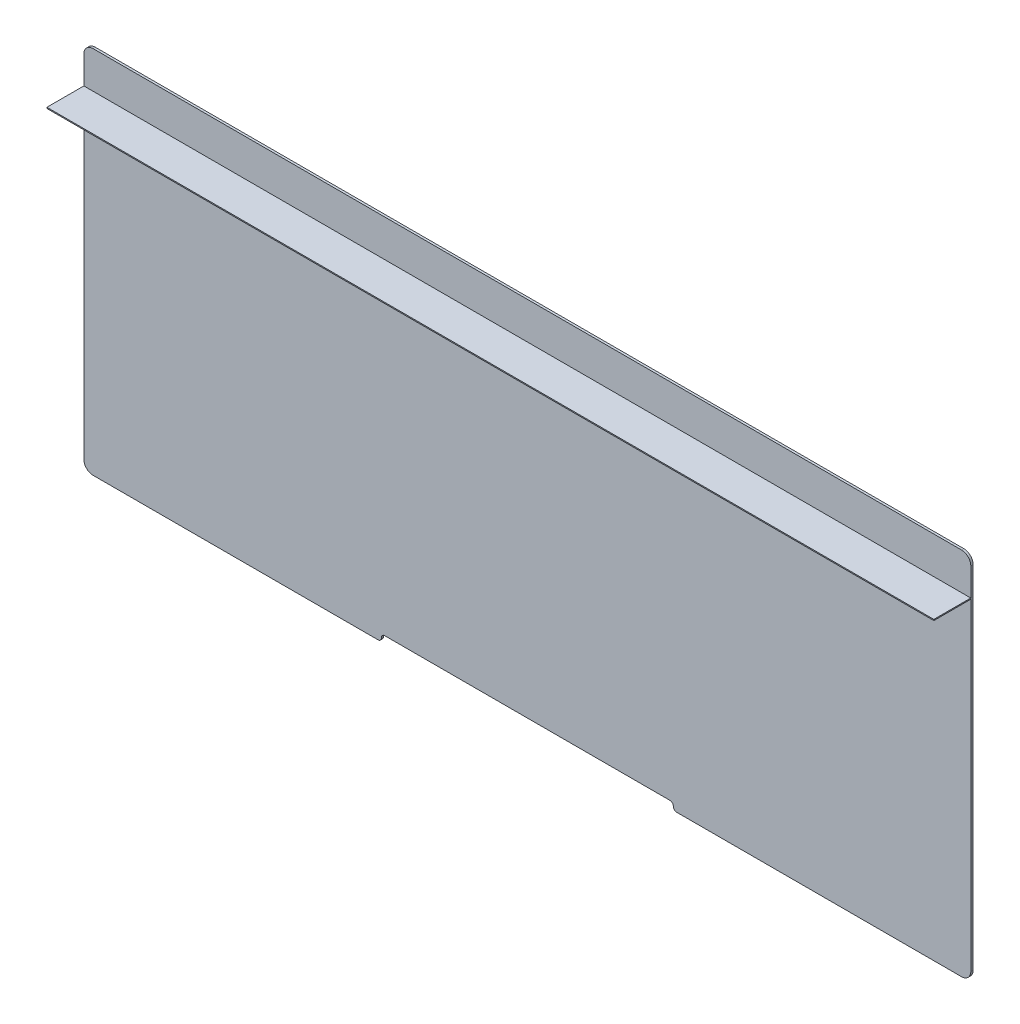
from build123d import *

# Parameters (mm, degrees)
BOSS_EXTRUDE1_DEPTH = 1.5875
SKETCH4_W           = 609.6
SKETCH4_H           = 0.7366
BASE_FLANGE1_DEPTH  = 25.4


# Sheet-metal steps are written as plain solids
with BuildPart() as part:
    # Sketch1 → Boss-Extrude1 (new body)
    with BuildSketch(Plane.XY):
        with BuildLine():
            Line((-409.757853403, 132.319371728), (187.142146597, 132.319371728))
            ThreePointArc((187.142146597, 132.319371728), (191.632274657, 130.459499788), (193.492146597, 125.969371728))
            Line((193.492146597, 125.969371728), (193.492146597, -115.330628272))
            ThreePointArc((193.492146597, -115.330628272), (191.632274657, -119.820756333), (187.142146597, -121.680628272))
            Line((187.142146597, -121.680628272), (-8.691853403, -121.680628272))
            ThreePointArc((-8.691853403, -121.680628272), (-10.308299505, -121.011074374), (-10.977853403, -119.394628272))
            Line((-10.977853403, -119.394628272), (-10.977853403, -119.204128272))
            ThreePointArc((-10.977853403, -119.204128272), (-11.647407301, -117.58768217), (-13.263853403, -116.918128272))
            Line((-13.263853403, -116.918128272), (-209.351853403, -116.918128272))
            ThreePointArc((-209.351853403, -116.918128272), (-210.968299505, -117.58768217), (-211.637853403, -119.204128272))
            Line((-211.637853403, -119.204128272), (-211.637853403, -119.394628272))
            ThreePointArc((-211.637853403, -119.394628272), (-212.307407301, -121.011074374), (-213.923853403, -121.680628272))
            Line((-213.923853403, -121.680628272), (-409.757853403, -121.680628272))
            ThreePointArc((-409.757853403, -121.680628272), (-414.247981464, -119.820756333), (-416.107853403, -115.330628272))
            Line((-416.107853403, -115.330628272), (-416.107853403, 125.969371728))
            ThreePointArc((-416.107853403, 125.969371728), (-414.247981464, 130.459499788), (-409.757853403, 132.319371728))
        make_face()
    extrude(amount=BOSS_EXTRUDE1_DEPTH)


with BuildPart() as body_2:
    # Sketch4 → Base-Flange1 (new body)
    with BuildSketch(Plane.XY.offset(1.5875)):
        with Locations((-111.307853403, 106.551071728)):
            Rectangle(SKETCH4_W, SKETCH4_H)
    extrude(amount=BASE_FLANGE1_DEPTH)


solid = Compound([part.part, body_2.part])
